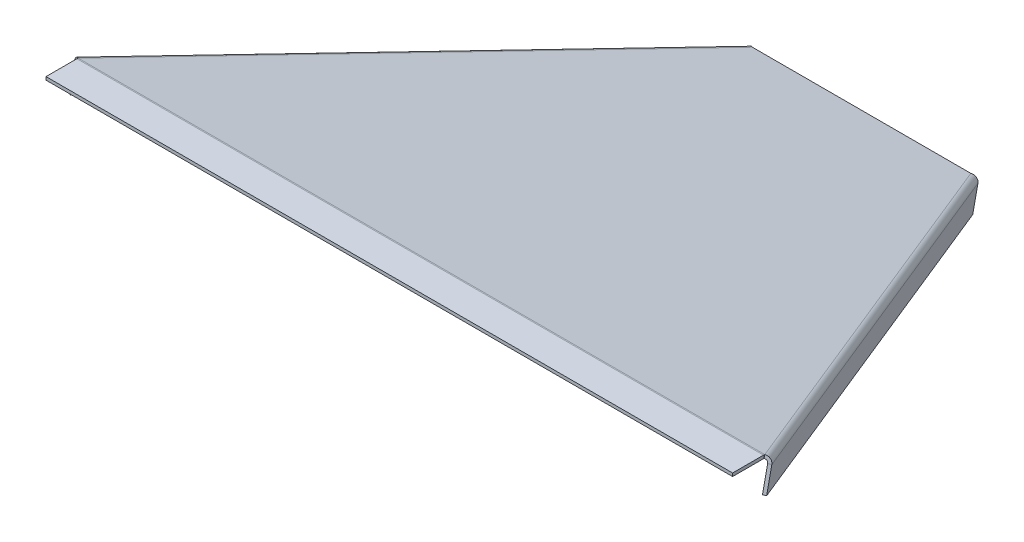
from build123d import *

# Parameters (mm, degrees)
BOSS_EXTRUDE1_DEPTH     = 279.4
CONVERT_SOLID1_START    = -279.4
CONVERT_SOLID1_DEPTH    = 558.8
CONVERT_SOLID1_2_DEPTH  = 558.8
CUT_EXTRUDE1_DEPTH      = 586.091506768
EDGE_FLANGE1_DEPTH      = 412.817360463
EDGE_FLANGE1_BEND_DEPTH = 412.817360463
CUT_EXTRUDE2_DEPTH      = 588.256983898
CUT_EXTRUDE2_DEPTH_BACK = 588.256983898
SKETCH12_R              = 7.9375


# Read off the part's stored shape, not the designer's step: Convert-Solid1
# Sheet-metal steps are written as plain solids
with BuildPart() as part:
    # Sketch3 → Boss-Extrude1 (new, symmetric)
    with BuildSketch(Plane(origin=(0, 0, 0), x_dir=(0, 0, -1), z_dir=(1, 0, 0))):
        Polygon((-477.990419123, 101.6), (-503.390419123, 101.6), (-503.390419123, 104.14), (-477.723454365, 104.14), (-118.969509086, 27.884494906), (-119.497604781, 25.4), align=None)
    extrude(amount=BOSS_EXTRUDE1_DEPTH, both=True)

    # Convert-Solid1 outline → Convert-Solid1 (cut)
    with BuildSketch(Plane.YZ.offset(CONVERT_SOLID1_START)):
        with BuildLine():
            Line((104.14, 477.723454365), (104.14, 478.257383881))
            ThreePointArc((104.14, 478.257383881), (104.112171228, 477.726379287), (104.028989812, 477.201192491))
            Line((104.028989812, 477.201192491), (104.14, 477.723454365))
        make_face()
    extrude(amount=CONVERT_SOLID1_DEPTH, mode=Mode.SUBTRACT)

    # Convert-Solid1 2 outline → Convert-Solid1 2 (add)
    with BuildSketch(Plane.YZ.offset(CONVERT_SOLID1_START)):
        with BuildLine():
            Line((101.6, 477.990419123), (101.6, 478.257383881))
            ThreePointArc((101.6, 478.257383881), (101.586085614, 477.991881584), (101.544494906, 477.729288186))
            Line((101.544494906, 477.729288186), (101.6, 477.990419123))
        make_face()
    extrude(amount=CONVERT_SOLID1_2_DEPTH)

    # Sketch8 → Cut-Extrude1 (cut, through all)
    with BuildSketch(Plane(origin=(0, 2.484494906, -0.528095695), x_dir=(1, 0, 0), z_dir=(0, 0.9781476007338071, -0.2079116908177526))):
        Polygon((279.4, -488.402044668), (88.9, -122.167252357), (279.4, -122.167252357), align=None)
        Polygon((-88.9, -122.167252357), (-279.4, -488.402044668), (-279.4, -122.167252357), align=None)
    extrude(amount=-CUT_EXTRUDE1_DEPTH, mode=Mode.SUBTRACT)

    # Edge-Flange1 section (across the edge) → Edge-Flange1 (add)
    with BuildSketch(Plane(origin=(91.153384818, 25.156303297, 118.351101933), x_dir=(-0.8871593769725213, 0.09594358400127492, 0.4513790741037053), z_dir=(0.4614631511288068, 0.18445080609118078, 0.8677728160541709))):
        with BuildLine():
            Line((-2.54, 2.54), (-2.54, 22.86))
            Line((-2.54, 22.86), (0, 22.86))
            Line((0, 22.86), (0, 2.54))
            ThreePointArc((0, 2.54), (0.743948776, 0.743948776), (2.54, 0))
            Line((2.54, 0), (2.54, -2.54))
            ThreePointArc((2.54, -2.54), (-1.052102448, -1.052102448), (-2.54, 2.54))
        make_face()
    extrude(amount=EDGE_FLANGE1_DEPTH)

    # Edge-Flange1 section 2 (across the edge) → Edge-Flange1 bend (add)
    with BuildSketch(Plane(origin=(-281.653384818, 101.300798203, 476.582785338), x_dir=(0.8871593769725281, 0.09594358400127215, 0.45137907410369243), z_dir=(0.4614631511287936, -0.18445080609118217, -0.8677728160541774))):
        with BuildLine():
            Line((-2.54, 2.54), (-2.54, 22.86))
            Line((-2.54, 22.86), (0, 22.86))
            Line((0, 22.86), (0, 2.54))
            ThreePointArc((0, 2.54), (0.743948776, 0.743948776), (2.54, 0))
            Line((2.54, 0), (2.54, -2.54))
            ThreePointArc((2.54, -2.54), (-1.052102448, -1.052102448), (-2.54, 2.54))
        make_face()
    extrude(amount=EDGE_FLANGE1_BEND_DEPTH)

    # Sketch12 → Cut-Extrude2 (cut, two sides: drawn at the far end of the back side and taken through both)
    with BuildSketch(Plane(origin=(0, 2.484494906, -0.528095695), x_dir=(1, 0, 0), z_dir=(0, 0.9781476007338071, -0.2079116908177526)).offset(-CUT_EXTRUDE2_DEPTH_BACK)):
        with Locations((-20.371926238, 129.188925745)):
            Circle(SKETCH12_R)
        with Locations((120.282042226, -141.217252357)):
            Circle(SKETCH12_R)
    cut_extrude2 = extrude(amount=CUT_EXTRUDE2_DEPTH + CUT_EXTRUDE2_DEPTH_BACK, mode=Mode.SUBTRACT)

    # Mirror8: Cut-Extrude2 across plane
    add(cut_extrude2.mirror(Plane(origin=(0, 0, 0), x_dir=(0, 0, 1), z_dir=(1, 0, 0))), mode=Mode.SUBTRACT)


solid = part.part
